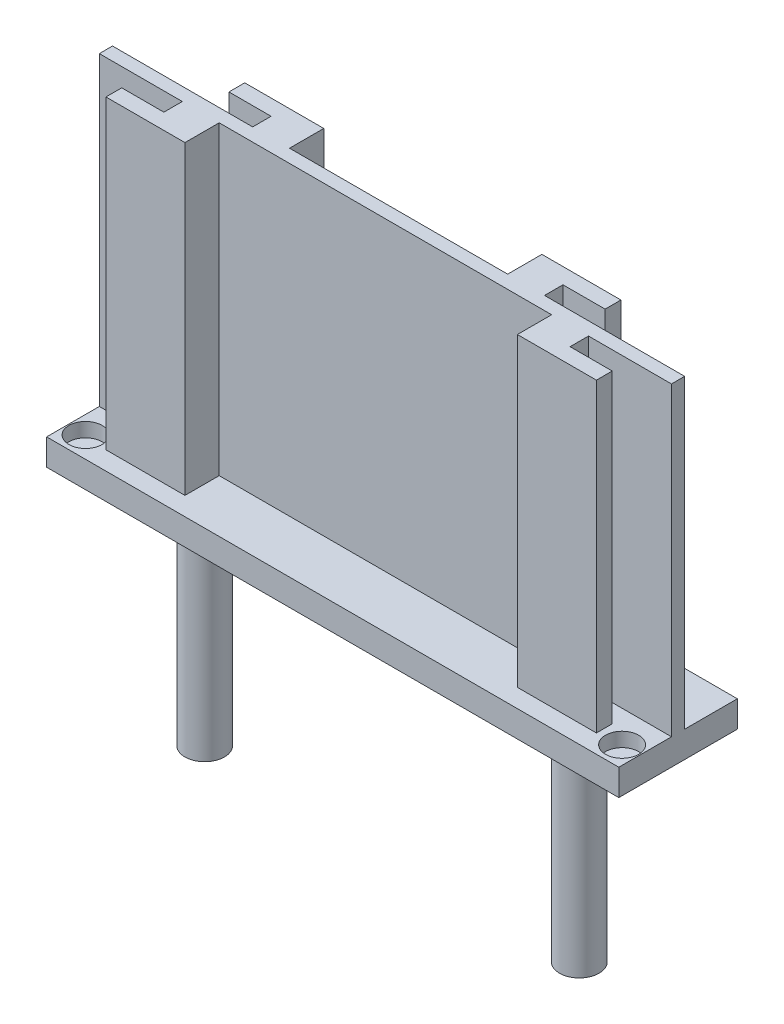
from build123d import *

# Parameters (mm, degrees)
SKETCH1_W           = 108.6
SKETCH1_H           = 22.5
BOSS_EXTRUDE1_DEPTH = 5
SKETCH2_R           = 3.15
CUT_EXTRUDE1_DEPTH  = 2.7
BOSS_EXTRUDE2_DEPTH = 58
SKETCH4_R           = 3.75
SKETCH4_R_2         = 1.5
BOSS_EXTRUDE3_DEPTH = 42
FILLET1_R           = 1


with BuildPart() as part:
    # Sketch1 → Boss-Extrude1 (new body)
    with BuildSketch(Plane(origin=(0, 0, 0), x_dir=(1, 0, 0), z_dir=(0, 1, 0))):
        Rectangle(SKETCH1_W, SKETCH1_H)
    extrude(amount=BOSS_EXTRUDE1_DEPTH)

    # Sketch2 → Cut-Extrude1 (cut)
    with BuildSketch(Plane(origin=(0, 5, 0), x_dir=(1, 0, 0), z_dir=(0, 1, 0))):
        with Locations((50.925, -7.25)):
            Circle(SKETCH2_R)
        with Locations((40.075, 7.25)):
            Circle(SKETCH2_R)
        with Locations((-50.925, -7.25)):
            Circle(SKETCH2_R)
        with Locations((-40.075, 7.25)):
            Circle(SKETCH2_R)
    extrude(amount=-CUT_EXTRUDE1_DEPTH, mode=Mode.SUBTRACT)

    # Sketch3 → Boss-Extrude2 (add)
    with BuildSketch(Plane(origin=(0, 5, 0), x_dir=(1, 0, 0), z_dir=(0, 1, 0))):
        Polygon((-54.3, 1.25), (-54.3, -1.25), (-38.55, -1.25), (-38.55, -4.75), (-46.55, -4.75), (-46.55, -7.75), (-31.55, -7.75), (-31.55, -1.25), (54.3, -1.25), (54.3, 1.25), (-20.7, 1.25), (-20.7, 7.75), (-35.7, 7.75), (-35.7, 4.75), (-27.7, 4.75), (-27.7, 1.25), align=None)
    boss_extrude2 = extrude(amount=BOSS_EXTRUDE2_DEPTH)

    # Mirror1: Boss-Extrude2 across plane
    add(boss_extrude2.mirror(Plane(origin=(0, 0, 0), x_dir=(0, 0, 1), z_dir=(1, 0, 0))))

    # Sketch4 → Boss-Extrude3 (add)
    # profile 1 of 2: a face of its own
    with BuildSketch(Plane.XZ):
        with Locations((-35.55, 0)):
            Circle(SKETCH4_R)
        with Locations((-35.55, 0)):
            Circle(SKETCH4_R_2, mode=Mode.SUBTRACT)
    # profile 2 of 2: a face of its own
    with BuildSketch(Plane.XZ):
        with Locations((35.55, 0)):
            Circle(SKETCH4_R)
        with Locations((35.55, 0)):
            Circle(SKETCH4_R_2, mode=Mode.SUBTRACT)
    extrude(amount=BOSS_EXTRUDE3_DEPTH)

    # Fillet1
    fillet1_edges = [part.edges().sort_by_distance(p)[0] for p in [
        (31.8, 0, 0),
        (-39.3, 0, 0),
    ]]
    fillet(fillet1_edges, radius=FILLET1_R)


solid = part.part
